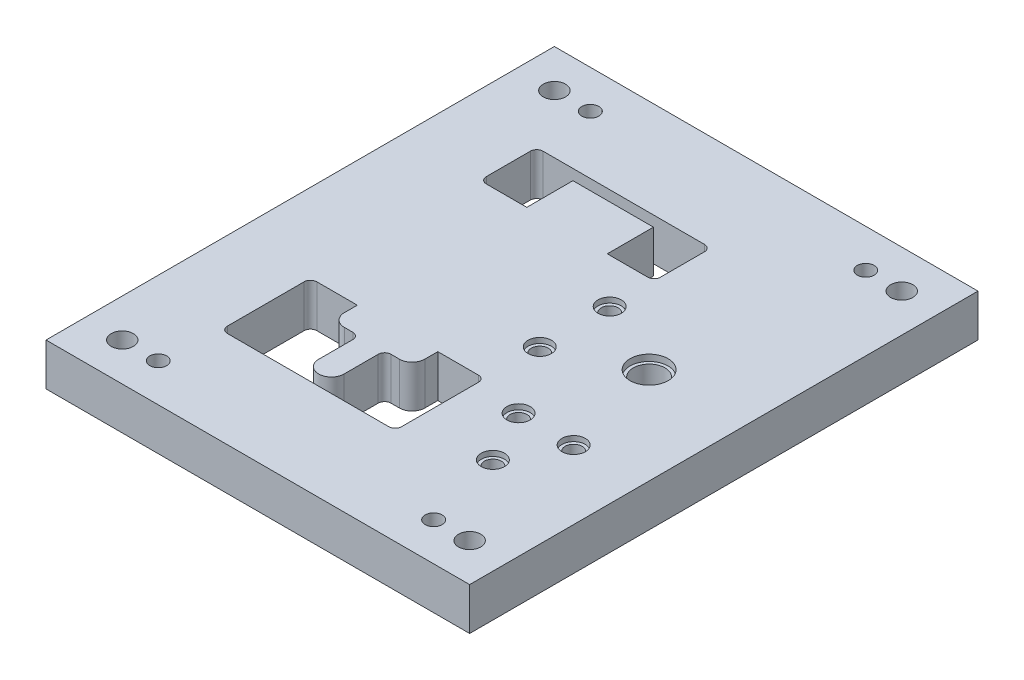
from build123d import *

# Parameters (mm, degrees)
SKETCH1_W                                    = 200
SKETCH1_H                                    = 240
BOSS_EXTRUDE1_DEPTH                          = 20
CUT_EXTRUDE3_REACH                           = 159.48
CUT_EXTRUDE4_REACH                           = 159.48
CUT_EXTRUDE5_REACH                           = 159.48
SKETCH7_R                                    = 4
CUT_EXTRUDE6_REACH                           = 159.48
SKETCH9_R                                    = 7.5
SKETCH10_R                                   = 5.5
CUT_EXTRUDE7_DEPTH                           = 2.5
SKETCH11_R                                   = 9
CUT_EXTRUDE8_DEPTH                           = 3
CBORE_FOR_M10_HEX_SOCKET_HEAD_CAP_SC_2_COUNT = 2
CBORE_FOR_M10_HEX_SOCKET_HEAD_CAP_SC_2_PITCH = 164
CBORE_FOR_M10_HEX_SOCKET_HEAD_CAP_SC_3_COUNT = 2
CBORE_FOR_M10_HEX_SOCKET_HEAD_CAP_SC_3_PITCH = 261.747970384
CBORE_FOR_M10_HEX_SOCKET_HEAD_CAP_SC_4_COUNT = 2
CBORE_FOR_M10_HEX_SOCKET_HEAD_CAP_SC_4_PITCH = 204
F_8_0MM_DOWEL_HOLE1_D                        = 8


with BuildPart() as part:
    # Sketch1 → Boss-Extrude1 (new body)
    with BuildSketch(Plane(origin=(0, 0, 0), x_dir=(1, 0, 0), z_dir=(0, 1, 0))):
        Rectangle(SKETCH1_W, SKETCH1_H)
    extrude(amount=-BOSS_EXTRUDE1_DEPTH)

    # Sketch5 → Cut-Extrude3 (cut, up to next)
    with BuildSketch(Plane(origin=(0, 0, 0), x_dir=(1, 0, 0), z_dir=(0, 1, 0)), mode=Mode.PRIVATE) as cut_extrude3_sk1:
        with BuildLine():
            Line((-62.87, -35.27), (-62.87, -71.53))
            ThreePointArc((-62.87, -71.53), (-61.991320344, -73.651320344), (-59.87, -74.53))
            Line((-59.87, -74.53), (16.37, -74.53))
            ThreePointArc((16.37, -74.53), (18.491320344, -73.651320344), (19.37, -71.53))
            Line((19.37, -71.53), (19.37, -35.27))
            ThreePointArc((19.37, -35.27), (18.491320344, -33.148679656), (16.37, -32.27))
            Line((16.37, -32.27), (-2.75, -32.27))
            Line((-2.75, -32.27), (-2.75, -38.4))
            ThreePointArc((-2.75, -38.4), (-4.507359313, -42.642640687), (-8.75, -44.4))
            Line((-8.75, -44.4), (-12.75, -44.4))
            ThreePointArc((-12.75, -44.4), (-14.871320344, -45.278679656), (-15.75, -47.4))
            Line((-15.75, -47.4), (-15.75, -63.53))
            ThreePointArc((-15.75, -63.53), (-21.75, -69.53), (-27.75, -63.53))
            Line((-27.75, -63.53), (-27.75, -47.4))
            ThreePointArc((-27.75, -47.4), (-28.628679656, -45.278679656), (-30.75, -44.4))
            Line((-30.75, -44.4), (-34.75, -44.4))
            ThreePointArc((-34.75, -44.4), (-38.992640687, -42.642640687), (-40.75, -38.4))
            Line((-40.75, -38.4), (-40.75, -32.27))
            Line((-40.75, -32.27), (-59.87, -32.27))
            ThreePointArc((-59.87, -32.27), (-61.991320344, -33.148679656), (-62.87, -35.27))
        make_face()
    cut_extrude3_tool1 = extrude(cut_extrude3_sk1.sketch, amount=-CUT_EXTRUDE3_REACH, mode=Mode.PRIVATE) & part.part
    add(cut_extrude3_tool1.solids().sort_by_distance((-39.64645, 0, 43.29645))[0], mode=Mode.SUBTRACT)

    # Sketch6 → Cut-Extrude4 (cut, up to next)
    with BuildSketch(Plane(origin=(0, 0, 0), x_dir=(1, 0, 0), z_dir=(0, 1, 0)), mode=Mode.PRIVATE) as cut_extrude4_sk1:
        with BuildLine():
            Line((-62.87, 50.73), (-62.87, 71.53))
            ThreePointArc((-62.87, 71.53), (-61.991320344, 73.651320344), (-59.87, 74.53))
            Line((-59.87, 74.53), (16.37, 74.53))
            ThreePointArc((16.37, 74.53), (18.491320344, 73.651320344), (19.37, 71.53))
            Line((19.37, 71.53), (19.37, 50.73))
            ThreePointArc((19.37, 50.73), (18.491320344, 48.608679656), (16.37, 47.73))
            Line((16.37, 47.73), (-2.75, 47.73))
            Line((-2.75, 47.73), (-2.75, 69.53))
            Line((-2.75, 69.53), (-40.75, 69.53))
            Line((-40.75, 69.53), (-40.75, 47.73))
            Line((-40.75, 47.73), (-59.87, 47.73))
            ThreePointArc((-59.87, 47.73), (-61.991320344, 48.608679656), (-62.87, 50.73))
        make_face()
    cut_extrude4_tool1 = extrude(cut_extrude4_sk1.sketch, amount=-CUT_EXTRUDE4_REACH, mode=Mode.PRIVATE) & part.part
    add(cut_extrude4_tool1.solids().sort_by_distance((-62.005034, 0, -61.13))[0], mode=Mode.SUBTRACT)

    # Sketch7 → Cut-Extrude5 (cut, up to next)
    with BuildSketch(Plane(origin=(0, 0, 0), x_dir=(1, 0, 0), z_dir=(0, 1, 0)), mode=Mode.PRIVATE) as cut_extrude5_sk1:
        with Locations((54.5, -63.53)):
            Circle(SKETCH7_R)
    cut_extrude5_tool1 = extrude(cut_extrude5_sk1.sketch, amount=-CUT_EXTRUDE5_REACH, mode=Mode.PRIVATE) & part.part
    # Sketch7 → Cut-Extrude5 (cut, up to next)
    with BuildSketch(Plane(origin=(0, 0, 0), x_dir=(1, 0, 0), z_dir=(0, 1, 0)), mode=Mode.PRIVATE) as cut_extrude5_sk2:
        with Locations((67.5, -38.4)):
            Circle(SKETCH7_R)
    cut_extrude5_tool2 = extrude(cut_extrude5_sk2.sketch, amount=-CUT_EXTRUDE5_REACH, mode=Mode.PRIVATE) & part.part
    # Sketch7 → Cut-Extrude5 (cut, up to next)
    with BuildSketch(Plane(origin=(0, 0, 0), x_dir=(1, 0, 0), z_dir=(0, 1, 0)), mode=Mode.PRIVATE) as cut_extrude5_sk3:
        with Locations((41.5, -38.4)):
            Circle(SKETCH7_R)
    cut_extrude5_tool3 = extrude(cut_extrude5_sk3.sketch, amount=-CUT_EXTRUDE5_REACH, mode=Mode.PRIVATE) & part.part
    # Sketch7 → Cut-Extrude5 (cut, up to next)
    with BuildSketch(Plane(origin=(0, 0, 0), x_dir=(1, 0, 0), z_dir=(0, 1, 0)), mode=Mode.PRIVATE) as cut_extrude5_sk4:
        with Locations((19.38, -6.27)):
            Circle(SKETCH7_R)
    cut_extrude5_tool4 = extrude(cut_extrude5_sk4.sketch, amount=-CUT_EXTRUDE5_REACH, mode=Mode.PRIVATE) & part.part
    # Sketch7 → Cut-Extrude5 (cut, up to next)
    with BuildSketch(Plane(origin=(0, 0, 0), x_dir=(1, 0, 0), z_dir=(0, 1, 0)), mode=Mode.PRIVATE) as cut_extrude5_sk5:
        with Locations((19.38, 26.73)):
            Circle(SKETCH7_R)
    cut_extrude5_tool5 = extrude(cut_extrude5_sk5.sketch, amount=-CUT_EXTRUDE5_REACH, mode=Mode.PRIVATE) & part.part
    add(cut_extrude5_tool1.solids().sort_by_distance((54.5, 0, 63.53))[0], mode=Mode.SUBTRACT)
    add(cut_extrude5_tool2.solids().sort_by_distance((67.5, 0, 38.4))[0], mode=Mode.SUBTRACT)
    add(cut_extrude5_tool3.solids().sort_by_distance((41.5, 0, 38.4))[0], mode=Mode.SUBTRACT)
    add(cut_extrude5_tool4.solids().sort_by_distance((19.38, 0, 6.27))[0], mode=Mode.SUBTRACT)
    add(cut_extrude5_tool5.solids().sort_by_distance((19.38, 0, -26.73))[0], mode=Mode.SUBTRACT)

    # Sketch9 → Cut-Extrude6 (cut, up to next)
    with BuildSketch(Plane(origin=(0, 0, 0), x_dir=(1, 0, 0), z_dir=(0, 1, 0)), mode=Mode.PRIVATE) as cut_extrude6_sk1:
        with Locations((54.5, 10.23)):
            Circle(SKETCH9_R)
    cut_extrude6_tool1 = extrude(cut_extrude6_sk1.sketch, amount=-CUT_EXTRUDE6_REACH, mode=Mode.PRIVATE) & part.part
    add(cut_extrude6_tool1.solids().sort_by_distance((54.5, 0, -10.23))[0], mode=Mode.SUBTRACT)

    # Sketch10 → Cut-Extrude7 (cut)
    with BuildSketch(Plane(origin=(0, 0, 0), x_dir=(1, 0, 0), z_dir=(0, 1, 0))):
        with Locations((19.38, 26.73)):
            Circle(SKETCH10_R)
        with Locations((19.38, -6.27)):
            Circle(SKETCH10_R)
        with Locations((41.5, -38.4)):
            Circle(SKETCH10_R)
        with Locations((67.5, -38.4)):
            Circle(SKETCH10_R)
        with Locations((54.5, -63.53)):
            Circle(SKETCH10_R)
    extrude(amount=-CUT_EXTRUDE7_DEPTH, mode=Mode.SUBTRACT)

    # Sketch11 → Cut-Extrude8 (cut)
    with BuildSketch(Plane(origin=(0, 0, 0), x_dir=(1, 0, 0), z_dir=(0, 1, 0))):
        with Locations((54.5, 10.23)):
            Circle(SKETCH11_R)
    extrude(amount=-CUT_EXTRUDE8_DEPTH, mode=Mode.SUBTRACT)

    # Sketch16 → CBORE for M10 Hex Socket Head Cap Screw1 (revolve, cut)
    with BuildSketch(Plane(origin=(82, -20, -102), x_dir=(0, 0, -1), z_dir=(1, 0, 0))):
        Polygon((0, 0), (0, 20), (5.25, 20), (5.25, 10.6), (9, 10.6), (9, 0.025), (9.025, 0), align=None)
    cbore_for_m10_hex_socket_head_cap_screw1 = revolve(axis=Axis((82, -26.35, -102), (0, 1, 0)), mode=Mode.SUBTRACT)

    # CBORE for M10 Hex Socket Head Cap Sc 2: CBORE for M10 Hex Socket Head Cap Screw1 ×2
    with Locations(*[(-i * CBORE_FOR_M10_HEX_SOCKET_HEAD_CAP_SC_2_PITCH, 0, 0) for i in range(1, CBORE_FOR_M10_HEX_SOCKET_HEAD_CAP_SC_2_COUNT)]):
        add(cbore_for_m10_hex_socket_head_cap_screw1, mode=Mode.SUBTRACT)

    # CBORE for M10 Hex Socket Head Cap Sc 3: CBORE for M10 Hex Socket Head Cap Screw1 ×2
    with Locations(*[Vector(-0.6265569118246599, 0, 0.7793756708062842) * (i * CBORE_FOR_M10_HEX_SOCKET_HEAD_CAP_SC_3_PITCH) for i in range(1, CBORE_FOR_M10_HEX_SOCKET_HEAD_CAP_SC_3_COUNT)]):
        add(cbore_for_m10_hex_socket_head_cap_screw1, mode=Mode.SUBTRACT)

    # CBORE for M10 Hex Socket Head Cap Sc 4: CBORE for M10 Hex Socket Head Cap Screw1 ×2
    with Locations(*[(0, 0, i * CBORE_FOR_M10_HEX_SOCKET_HEAD_CAP_SC_4_PITCH) for i in range(1, CBORE_FOR_M10_HEX_SOCKET_HEAD_CAP_SC_4_COUNT)]):
        add(cbore_for_m10_hex_socket_head_cap_screw1, mode=Mode.SUBTRACT)

    # Ø8.0mm Dowel Hole1 (through all)
    with Locations(Plane(origin=(0, -20, 0), x_dir=(-1, 0, 0), z_dir=(0, -1, 0))):
        with Locations((-65, 102), (65, 102), (65, -102), (-65, -102)):
            Hole(F_8_0MM_DOWEL_HOLE1_D / 2)


solid = part.part
